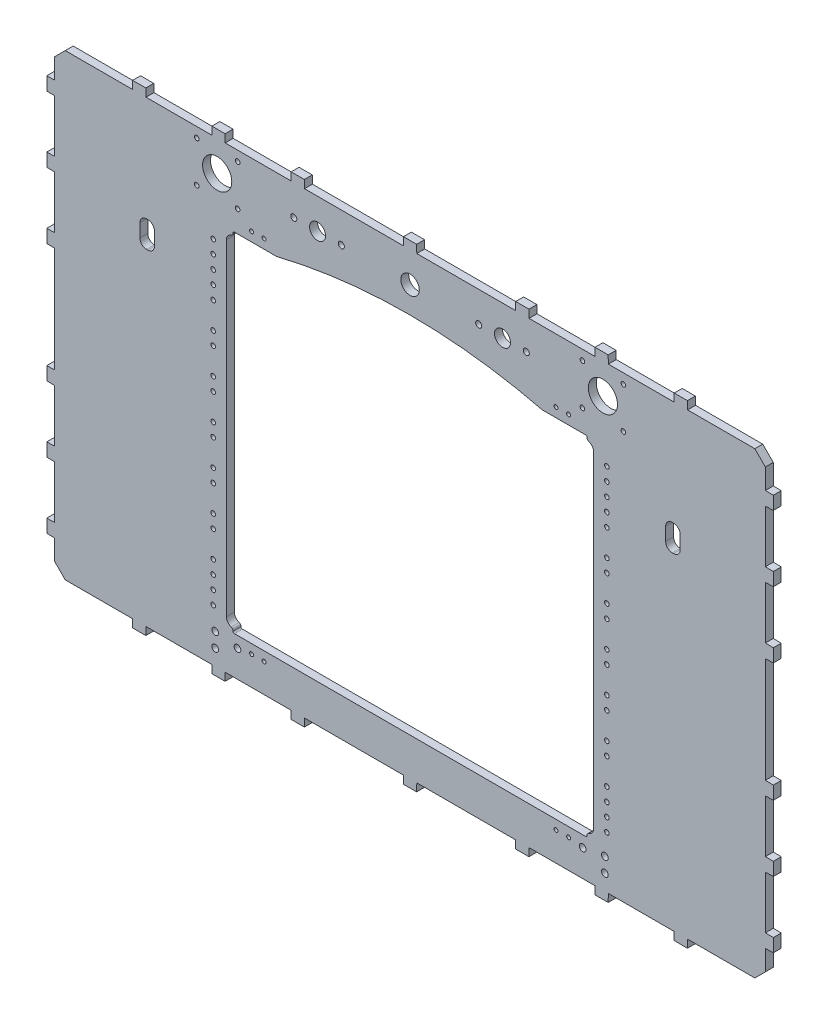
from build123d import *

# Parameters (mm, degrees)
SKETCH_1_R      = 1.5
SKETCH_1_R_2    = 2.55
SKETCH_1_R_3    = 1.75
SKETCH_1_R_4    = 11.05
SKETCH_1_R_5    = 2.3
SKETCH_1_R_6    = 6.05
SKETCH_1_R_7    = 7
EXTRUDE_1_DEPTH = 6


with BuildPart() as part:
    # Эскиз1 → Бобышка-Вытянуть1 (new body)
    with BuildSketch(Plane.XY):
        Polygon((1843.680450761, 414.691345467), (1893.480450761, 414.691345467), (1893.580450761, 408.691345469), (1903.580450761, 408.691345469), (1903.680450761, 414.691345467), (1954.58045076, 414.691345467), (1962.58045076, 422.691345467), (1962.58045076, 438.091345466), (1968.580450759, 438.191345467), (1968.580450759, 448.191345467), (1962.580450761, 448.291345467), (1962.580450761, 488.091345466), (1968.580450759, 488.191345467), (1968.580450759, 498.191345467), (1962.580450761, 498.291345467), (1962.580450761, 538.091345466), (1968.580450759, 538.191345467), (1968.580450759, 548.191345467), (1962.580450761, 548.291345467), (1962.580450761, 628.091345466), (1968.580450759, 628.191345467), (1968.580450759, 638.191345467), (1962.580450761, 638.291345467), (1962.580450761, 678.091345466), (1968.580450759, 678.191345467), (1968.580450759, 688.191345467), (1962.580450761, 688.291345467), (1962.580450761, 728.091345466), (1968.580450759, 728.191345467), (1968.580450759, 738.191345467), (1962.580450761, 738.291345469), (1962.580450761, 753.691345469), (1954.580450761, 761.691345469), (1903.680450761, 761.691345469), (1903.58045076, 767.691345468), (1893.58045076, 767.691345468), (1893.48045076, 761.691345469), (1854.58045076, 761.691345469), (1843.680450761, 761.691345469), (1843.58045076, 767.691345468), (1833.58045076, 767.691345468), (1833.48045076, 761.691345469), (1783.680450761, 761.691345469), (1783.58045076, 767.691345468), (1773.58045076, 767.691345468), (1773.48045076, 761.691345469), (1698.680450762, 761.691345469), (1698.580450761, 767.691345468), (1688.580450761, 767.691345468), (1688.480450761, 761.691345469), (1613.680450761, 761.691345469), (1613.58045076, 767.691345468), (1603.58045076, 767.691345468), (1603.48045076, 761.691345469), (1553.680450761, 761.691345469), (1553.58045076, 767.691345468), (1543.58045076, 767.691345468), (1543.48045076, 761.691345469), (1532.58045076, 761.691345469), (1493.680450761, 761.691345469), (1493.58045076, 767.691345468), (1483.58045076, 767.691345468), (1483.48045076, 761.691345469), (1432.580450761, 761.691345469), (1424.580450761, 753.691345469), (1424.580450761, 738.291345469), (1418.580450762, 738.191345469), (1418.580450762, 728.191345469), (1424.580450761, 728.091345469), (1424.580450761, 688.291345469), (1418.580450762, 688.191345469), (1418.580450762, 678.191345469), (1424.580450761, 678.091345469), (1424.580450761, 638.291345469), (1418.580450762, 638.191345469), (1418.580450762, 628.191345469), (1424.580450761, 628.091345469), (1424.580450761, 548.291345469), (1418.580450762, 548.191345469), (1418.580450762, 538.191345469), (1424.580450761, 538.091345468), (1424.580450761, 498.291345469), (1418.580450762, 498.191345469), (1418.580450762, 488.191345469), (1424.58045076, 488.091345468), (1424.58045076, 448.291345469), (1418.580450762, 448.191345469), (1418.580450762, 438.191345469), (1424.58045076, 438.091345468), (1424.58045076, 422.691345469), (1432.58045076, 414.691345469), (1483.48045076, 414.691345469), (1483.580450761, 408.69134547), (1493.580450761, 408.69134547), (1493.680450761, 414.691345469), (1532.58045076, 414.691345469), (1543.48045076, 414.691345469), (1543.580450761, 408.69134547), (1553.580450761, 408.69134547), (1553.680450761, 414.691345469), (1603.48045076, 414.691345469), (1603.580450761, 408.69134547), (1613.580450761, 408.69134547), (1613.680450761, 414.691345468), (1688.480450761, 414.691345468), (1688.580450761, 408.691345469), (1698.580450761, 408.691345469), (1698.680450761, 414.691345468), (1773.480450761, 414.691345468), (1773.580450761, 408.691345469), (1783.580450761, 408.691345469), (1783.680450761, 414.691345467), (1833.480450761, 414.691345467), (1833.580450761, 408.691345469), (1843.580450761, 408.691345469), align=None)
        with Locations((1804.08045076, 436.470646701)):
            Circle(SKETCH_1_R, mode=Mode.SUBTRACT)
        with Locations((1813.58045076, 436.470646701)):
            Circle(SKETCH_1_R, mode=Mode.SUBTRACT)
        with Locations((1824.227659727, 434.980879116)):
            Circle(SKETCH_1_R_2, mode=Mode.SUBTRACT)
        with Locations((1841.08045076, 426.691345469)):
            Circle(SKETCH_1_R_2, mode=Mode.SUBTRACT)
        with Locations((1841.08045076, 437.691345469)):
            Circle(SKETCH_1_R_2, mode=Mode.SUBTRACT)
        with Locations((1842.58045076, 454.191345469)):
            Circle(SKETCH_1_R_3, mode=Mode.SUBTRACT)
        with Locations((1842.58045076, 464.191345469)):
            Circle(SKETCH_1_R_3, mode=Mode.SUBTRACT)
        with Locations((1842.58045076, 474.191345469)):
            Circle(SKETCH_1_R_3, mode=Mode.SUBTRACT)
        with Locations((1842.58045076, 484.191345469)):
            Circle(SKETCH_1_R_3, mode=Mode.SUBTRACT)
        with Locations((1842.58045076, 504.191345469)):
            Circle(SKETCH_1_R_3, mode=Mode.SUBTRACT)
        with Locations((1842.58045076, 514.191345469)):
            Circle(SKETCH_1_R_3, mode=Mode.SUBTRACT)
        with Locations((1842.58045076, 534.191345469)):
            Circle(SKETCH_1_R_3, mode=Mode.SUBTRACT)
        with Locations((1842.58045076, 544.191345469)):
            Circle(SKETCH_1_R_3, mode=Mode.SUBTRACT)
        with Locations((1842.58045076, 564.191345469)):
            Circle(SKETCH_1_R_3, mode=Mode.SUBTRACT)
        with Locations((1842.58045076, 574.191345469)):
            Circle(SKETCH_1_R_3, mode=Mode.SUBTRACT)
        with Locations((1842.58045076, 594.191345469)):
            Circle(SKETCH_1_R_3, mode=Mode.SUBTRACT)
        with Locations((1842.58045076, 604.191345469)):
            Circle(SKETCH_1_R_3, mode=Mode.SUBTRACT)
        with Locations((1842.58045076, 624.191345469)):
            Circle(SKETCH_1_R_3, mode=Mode.SUBTRACT)
        with Locations((1842.58045076, 634.191345469)):
            Circle(SKETCH_1_R_3, mode=Mode.SUBTRACT)
        with Locations((1842.58045076, 654.191345469)):
            Circle(SKETCH_1_R_3, mode=Mode.SUBTRACT)
        with Locations((1842.58045076, 664.191345469)):
            Circle(SKETCH_1_R_3, mode=Mode.SUBTRACT)
        with Locations((1842.58045076, 674.191345469)):
            Circle(SKETCH_1_R_3, mode=Mode.SUBTRACT)
        with Locations((1842.58045076, 684.191345469)):
            Circle(SKETCH_1_R_3, mode=Mode.SUBTRACT)
        with Locations((1842.58045076, 694.191345469)):
            Circle(SKETCH_1_R_3, mode=Mode.SUBTRACT)
        with Locations((1583.08045076, 436.470646701)):
            Circle(SKETCH_1_R, mode=Mode.SUBTRACT)
        with Locations((1573.58045076, 436.470646701)):
            Circle(SKETCH_1_R, mode=Mode.SUBTRACT)
        with Locations((1562.93045076, 434.980879116)):
            Circle(SKETCH_1_R_2, mode=Mode.SUBTRACT)
        with Locations((1546.08045076, 426.691345469)):
            Circle(SKETCH_1_R_2, mode=Mode.SUBTRACT)
        with Locations((1546.08045076, 437.691345469)):
            Circle(SKETCH_1_R_2, mode=Mode.SUBTRACT)
        with Locations((1544.58045076, 454.191345688)):
            Circle(SKETCH_1_R_3, mode=Mode.SUBTRACT)
        with Locations((1544.58045076, 464.191345688)):
            Circle(SKETCH_1_R_3, mode=Mode.SUBTRACT)
        with Locations((1544.58045076, 474.191345688)):
            Circle(SKETCH_1_R_3, mode=Mode.SUBTRACT)
        with Locations((1544.58045076, 484.191345688)):
            Circle(SKETCH_1_R_3, mode=Mode.SUBTRACT)
        with Locations((1544.58045076, 504.191345688)):
            Circle(SKETCH_1_R_3, mode=Mode.SUBTRACT)
        with Locations((1544.58045076, 514.191345688)):
            Circle(SKETCH_1_R_3, mode=Mode.SUBTRACT)
        with Locations((1544.58045076, 534.191345688)):
            Circle(SKETCH_1_R_3, mode=Mode.SUBTRACT)
        with Locations((1544.58045076, 544.191345688)):
            Circle(SKETCH_1_R_3, mode=Mode.SUBTRACT)
        with Locations((1544.58045076, 564.191345688)):
            Circle(SKETCH_1_R_3, mode=Mode.SUBTRACT)
        with Locations((1544.58045076, 574.191345688)):
            Circle(SKETCH_1_R_3, mode=Mode.SUBTRACT)
        with Locations((1544.58045076, 594.191345688)):
            Circle(SKETCH_1_R_3, mode=Mode.SUBTRACT)
        with Locations((1544.58045076, 604.191345688)):
            Circle(SKETCH_1_R_3, mode=Mode.SUBTRACT)
        with Locations((1544.58045076, 624.191345688)):
            Circle(SKETCH_1_R_3, mode=Mode.SUBTRACT)
        with Locations((1544.58045076, 634.191345688)):
            Circle(SKETCH_1_R_3, mode=Mode.SUBTRACT)
        with Locations((1544.58045076, 654.191345688)):
            Circle(SKETCH_1_R_3, mode=Mode.SUBTRACT)
        with Locations((1544.58045076, 664.191345688)):
            Circle(SKETCH_1_R_3, mode=Mode.SUBTRACT)
        with Locations((1544.58045076, 674.191345688)):
            Circle(SKETCH_1_R_3, mode=Mode.SUBTRACT)
        with Locations((1544.58045076, 684.191345688)):
            Circle(SKETCH_1_R_3, mode=Mode.SUBTRACT)
        with Locations((1544.58045076, 694.191345688)):
            Circle(SKETCH_1_R_3, mode=Mode.SUBTRACT)
        with Locations((1804.08045076, 713.691345469)):
            Circle(SKETCH_1_R, mode=Mode.SUBTRACT)
        with Locations((1813.58045076, 713.691345469)):
            Circle(SKETCH_1_R, mode=Mode.SUBTRACT)
        with Locations((1824.08045076, 723.191345469)):
            Circle(SKETCH_1_R_3, mode=Mode.SUBTRACT)
        with Locations((1855.08045076, 723.191345469)):
            Circle(SKETCH_1_R_3, mode=Mode.SUBTRACT)
        with Locations((1839.58045076, 738.691345469)):
            Circle(SKETCH_1_R_4, mode=Mode.SUBTRACT)
        with Locations((1855.08045076, 754.191345469)):
            Circle(SKETCH_1_R_3, mode=Mode.SUBTRACT)
        with Locations((1824.08045076, 754.191345469)):
            Circle(SKETCH_1_R_3, mode=Mode.SUBTRACT)
        with Locations((1781.58045076, 738.691345469)):
            Circle(SKETCH_1_R_5, mode=Mode.SUBTRACT)
        with Locations((1763.58045076, 738.691345469)):
            Circle(SKETCH_1_R_6, mode=Mode.SUBTRACT)
        with Locations((1745.58045076, 738.691345469)):
            Circle(SKETCH_1_R_5, mode=Mode.SUBTRACT)
        with Locations((1693.58045076, 738.691345469)):
            Circle(SKETCH_1_R_7, mode=Mode.SUBTRACT)
        with Locations((1641.58045076, 738.691345469)):
            Circle(SKETCH_1_R_5, mode=Mode.SUBTRACT)
        with Locations((1623.58045076, 738.691345469)):
            Circle(SKETCH_1_R_6, mode=Mode.SUBTRACT)
        with Locations((1605.58045076, 738.691345469)):
            Circle(SKETCH_1_R_5, mode=Mode.SUBTRACT)
        with Locations((1583.08045076, 713.691345469)):
            Circle(SKETCH_1_R, mode=Mode.SUBTRACT)
        with Locations((1573.58045076, 713.691345469)):
            Circle(SKETCH_1_R, mode=Mode.SUBTRACT)
        with Locations((1563.08045076, 723.191345469)):
            Circle(SKETCH_1_R_3, mode=Mode.SUBTRACT)
        with Locations((1563.08045076, 754.191345469)):
            Circle(SKETCH_1_R_3, mode=Mode.SUBTRACT)
        with Locations((1547.58045076, 738.691345469)):
            Circle(SKETCH_1_R_4, mode=Mode.SUBTRACT)
        with Locations((1532.08045076, 723.191345469)):
            Circle(SKETCH_1_R_3, mode=Mode.SUBTRACT)
        with Locations((1532.08045076, 754.191345469)):
            Circle(SKETCH_1_R_3, mode=Mode.SUBTRACT)
        with BuildLine():
            Line((1554.58045076, 451.470646701), (1554.58045076, 698.691345469))
            ThreePointArc((1554.58045076, 698.691345469), (1555.571532132, 701.679416993), (1558.151879332, 703.482919707))
            ThreePointArc((1558.151879332, 703.482919707), (1559.184018212, 704.204320793), (1559.58045076, 705.399549402))
            Line((1559.58045076, 705.399549402), (1559.58045076, 705.691345469))
            ThreePointArc((1559.58045076, 705.691345469), (1559.873343979, 706.398452251), (1560.58045076, 706.691345469))
            Line((1560.58045076, 706.691345469), (1592.563784093, 706.691345469))
            ThreePointArc((1592.563784093, 706.691345469), (1693.122117427, 718.84112619), (1793.680450761, 706.691345469))
            Line((1793.680450761, 706.691345469), (1826.580467982, 706.691345469))
            ThreePointArc((1826.580467982, 706.691345469), (1827.287574764, 706.398452251), (1827.580467982, 705.691345469))
            Line((1827.580467982, 705.691345469), (1827.580467982, 705.399549402))
            ThreePointArc((1827.580467982, 705.399549402), (1827.976900531, 704.204320793), (1829.009039411, 703.482919707))
            ThreePointArc((1829.009039411, 703.482919707), (1831.589391061, 701.679411023), (1832.580467982, 698.691330578))
            Line((1832.580467982, 698.691330578), (1832.579713792, 451.470631809))
            ThreePointArc((1832.579713792, 451.470631809), (1831.588627971, 448.482569208), (1829.008285221, 446.679072463))
            ThreePointArc((1829.008285221, 446.679072463), (1827.976146341, 445.957671378), (1827.579713792, 444.762442768))
            Line((1827.579713792, 444.762442768), (1827.579713792, 444.470646701))
            ThreePointArc((1827.579713792, 444.470646701), (1827.286820574, 443.76353992), (1826.579713792, 443.470646701))
            Line((1826.579713792, 443.470646701), (1560.58045076, 443.470646701))
            ThreePointArc((1560.58045076, 443.470646701), (1559.873343979, 443.763539919), (1559.58045076, 444.470646701))
            Line((1559.58045076, 444.470646701), (1559.58045076, 444.762442768))
            ThreePointArc((1559.58045076, 444.762442768), (1559.184018212, 445.957671377), (1558.151879332, 446.679072463))
            ThreePointArc((1558.151879332, 446.679072463), (1555.571532132, 448.482575177), (1554.58045076, 451.470646701))
        make_face(mode=Mode.SUBTRACT)
        with BuildLine():
            Line((1495.08045076, 662.129652746), (1494.08045076, 662.129652746))
            ThreePointArc((1494.08045076, 662.129652746), (1490.544916854, 663.59411884), (1489.08045076, 667.129652746))
            Line((1489.08045076, 667.129652746), (1489.08045076, 677.129652746))
            ThreePointArc((1489.08045076, 677.129652746), (1490.544916854, 680.665186652), (1494.08045076, 682.129652746))
            Line((1494.08045076, 682.129652746), (1495.08045076, 682.129652746))
            ThreePointArc((1495.08045076, 682.129652746), (1498.615984666, 680.665186652), (1500.08045076, 677.129652746))
            Line((1500.08045076, 677.129652746), (1500.08045076, 667.129652746))
            ThreePointArc((1500.08045076, 667.129652746), (1498.615984666, 663.59411884), (1495.08045076, 662.129652746))
        make_face(mode=Mode.SUBTRACT)
        with BuildLine():
            Line((1892.08045076, 682.129652746), (1893.08045076, 682.129652746))
            ThreePointArc((1893.08045076, 682.129652746), (1896.615984666, 680.665186652), (1898.08045076, 677.129652746))
            Line((1898.08045076, 677.129652746), (1898.08045076, 667.129652746))
            ThreePointArc((1898.08045076, 667.129652746), (1896.615984666, 663.59411884), (1893.08045076, 662.129652746))
            Line((1893.08045076, 662.129652746), (1892.08045076, 662.129652746))
            ThreePointArc((1892.08045076, 662.129652746), (1888.544916854, 663.59411884), (1887.08045076, 667.129652746))
            Line((1887.08045076, 667.129652746), (1887.08045076, 677.129652746))
            ThreePointArc((1887.08045076, 677.129652746), (1888.544916854, 680.665186652), (1892.08045076, 682.129652746))
        make_face(mode=Mode.SUBTRACT)
    extrude(amount=EXTRUDE_1_DEPTH)


solid = part.part
